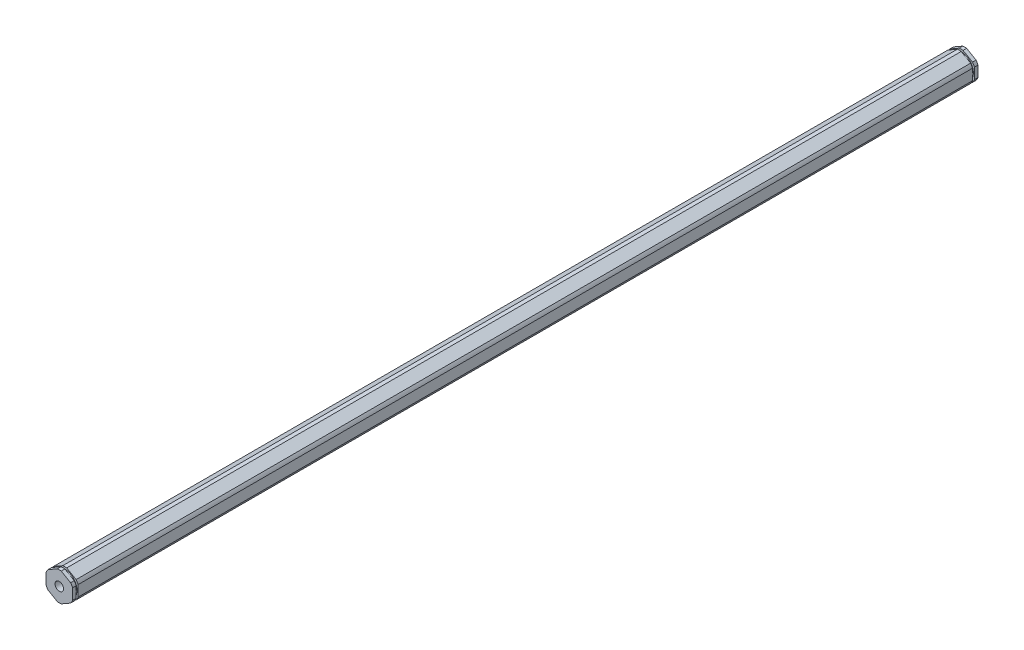
from build123d import *

# Parameters (mm, degrees)
BOSS_EXTRUDE1_DEPTH                  = 216.11717
F_10_32_TAPPED_HOLE1_D               = 4.0386
F_10_32_TAPPED_HOLE1_DEPTH           = 16.34744
F_10_32_TAPPED_HOLE1_TIP             = 1.213317848
F_10_32_TAPPED_HOLE1_ON_FACE_2_D     = 4.0386
F_10_32_TAPPED_HOLE1_ON_FACE_2_DEPTH = 16.34744
F_10_32_TAPPED_HOLE1_ON_FACE_2_TIP   = 1.213317848
SKETCH5_W                            = 0.889
SKETCH5_H                            = 1.0033


with BuildPart() as part:
    # Sketch1 → Boss-Extrude1 (new, symmetric)
    with BuildSketch(Plane.XY):
        with BuildLine():
            ThreePointArc((0.93173274, 6.79441227), (0, 6.858), (-0.93173274, 6.79441227))
            Line((-0.93173274, 6.79441227), (-5.41826726, 4.204110358))
            ThreePointArc((-5.41826726, 4.204110358), (-5.939202219, 3.429), (-6.35, 2.590301913))
            Line((-6.35, 2.590301913), (-6.35, -2.590301913))
            ThreePointArc((-6.35, -2.590301913), (-5.939202219, -3.429), (-5.41826726, -4.204110358))
            Line((-5.41826726, -4.204110358), (-0.93173274, -6.79441227))
            ThreePointArc((-0.93173274, -6.79441227), (0, -6.858), (0.93173274, -6.79441227))
            Line((0.93173274, -6.79441227), (5.41826726, -4.204110358))
            ThreePointArc((5.41826726, -4.204110358), (5.939202219, -3.429), (6.35, -2.590301913))
            Line((6.35, -2.590301913), (6.35, 2.590301913))
            ThreePointArc((6.35, 2.590301913), (5.939202219, 3.429), (5.41826726, 4.204110358))
            Line((5.41826726, 4.204110358), (0.93173274, 6.79441227))
        make_face()
    extrude(amount=BOSS_EXTRUDE1_DEPTH, both=True)

    # #10-32 Tapped Hole1
    with Locations(Plane.XY.offset(216.11717)):
        with Locations((0, 0)):
            Hole(F_10_32_TAPPED_HOLE1_D / 2, depth=F_10_32_TAPPED_HOLE1_DEPTH)
            with Locations((0, 0, -(F_10_32_TAPPED_HOLE1_DEPTH + F_10_32_TAPPED_HOLE1_TIP / 2))):  # 118° drill point
                Cone(0, F_10_32_TAPPED_HOLE1_D / 2, F_10_32_TAPPED_HOLE1_TIP, mode=Mode.SUBTRACT)

    # #10-32 Tapped Hole1 on face 2
    with Locations(Plane(origin=(0, 0, -216.11717), x_dir=(-1, 0, 0), z_dir=(0, 0, -1))):
        with Locations((0, 0)):
            Hole(F_10_32_TAPPED_HOLE1_ON_FACE_2_D / 2, depth=F_10_32_TAPPED_HOLE1_ON_FACE_2_DEPTH)
            with Locations((0, 0, -(F_10_32_TAPPED_HOLE1_ON_FACE_2_DEPTH + F_10_32_TAPPED_HOLE1_ON_FACE_2_TIP / 2))):  # 118° drill point
                Cone(0, F_10_32_TAPPED_HOLE1_ON_FACE_2_D / 2, F_10_32_TAPPED_HOLE1_ON_FACE_2_TIP, mode=Mode.SUBTRACT)

    # Sketch5 → Cut-Revolve1 (revolve, cut)
    with BuildSketch(Plane(origin=(0, 0, 0), x_dir=(0, 0, -1), z_dir=(1, 0, 0))):
        with Locations((-213.95817, 6.35635)):
            Rectangle(SKETCH5_W, SKETCH5_H)
    cut_revolve1 = revolve(axis=Axis((0, 0, 165.047176272), (0, 0, -1)), mode=Mode.SUBTRACT)

    # Mirror1: Cut-Revolve1 across plane
    add(cut_revolve1.mirror(Plane.XY), mode=Mode.SUBTRACT)


solid = part.part
